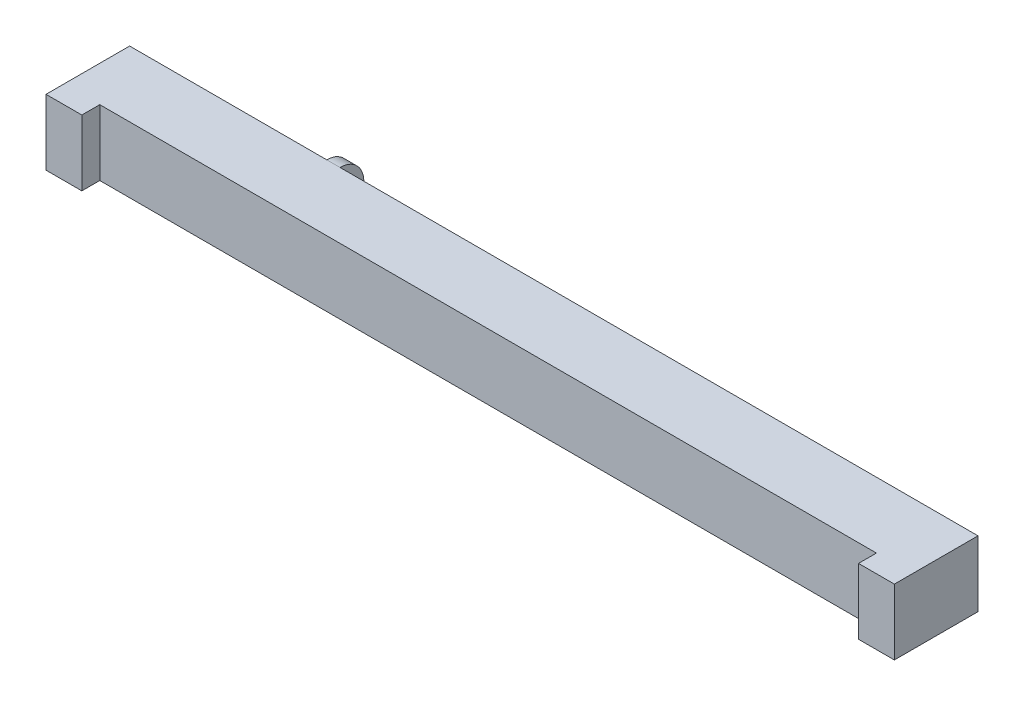
from build123d import *

# Parameters (mm, degrees)
SKETCH1_W          = 71
SKETCH1_H          = 7
EXTRUDE1_DEPTH     = 5.5
SKETCH2_W          = 65
SKETCH2_H          = 2.766320183
CUT_EXTRUDE1_DEPTH = 7.5
SKETCH3_W          = 63
SKETCH3_H          = 2
EXTRUDE2_DEPTH     = 5.5
SKETCH4_W          = 49.4
SKETCH4_H          = 2
SKETCH4_W_2        = 12.5
CUT_EXTRUDE2_DEPTH = 2.9
FILLET1_R          = 2
EXTRUDE3_START     = 1.955331485
EXTRUDE3_DEPTH     = 2.978778395
EXTRUDE3_START_2   = -35.5
EXTRUDE3_2_DEPTH   = 71


with BuildPart() as part:
    # Sketch1 → Extrude1 (new body)
    with BuildSketch(Plane(origin=(0, 0, 0), x_dir=(1, 0, 0), z_dir=(0, 1, 0))):
        Rectangle(SKETCH1_W, SKETCH1_H)
    extrude(amount=EXTRUDE1_DEPTH)

    # Sketch2 → Cut-Extrude1 (cut)
    with BuildSketch(Plane(origin=(0, 5.5, 0), x_dir=(-1, 0, 0), z_dir=(0, 1, 0))):
        with Locations((0, 3.383160092)):
            Rectangle(SKETCH2_W, SKETCH2_H)
    extrude(amount=-CUT_EXTRUDE1_DEPTH, mode=Mode.SUBTRACT)

    # Sketch3 → Extrude2 (add)
    with BuildSketch(Plane(origin=(0, 5.5, 0), x_dir=(-1, 0, 0), z_dir=(0, 1, 0))):
        with Locations((0, -4.5)):
            Rectangle(SKETCH3_W, SKETCH3_H)
    extrude(amount=-EXTRUDE2_DEPTH)

    # Sketch4 → Cut-Extrude2 (cut)
    with BuildSketch(Plane(origin=(0, 5.5, 0), x_dir=(-1, 0, 0), z_dir=(0, 1, 0))):
        with Locations((-6.8, -4.5)):
            Rectangle(SKETCH4_W, SKETCH4_H)
        with Locations((25.25, -4.5)):
            Rectangle(SKETCH4_W_2, SKETCH4_H)
    extrude(amount=-CUT_EXTRUDE2_DEPTH, mode=Mode.SUBTRACT)

    # Fillet1
    fillet1_edges = [part.edges().sort_by_distance(p)[0] for p in [
        (-18.45, 5.5, -5.5),
    ]]
    fillet(fillet1_edges, radius=FILLET1_R)

    # Extrude3: read off the stored shape, not the designer's step
    # Extrude3 outline → Extrude3 (cut)
    with BuildSketch(Plane(origin=(0, 0, 0), x_dir=(1, 0, 0), z_dir=(0, 1, 0)).offset(EXTRUDE3_START)):
        Polygon((-19, 3.5), (-34.670728733, 3.5), (-35.248026649, 0.655722687), (35.324444086, 0.655722687), (34.74714617, 3.5), (-17.9, 3.5), (-18.45, 0.790216232), align=None)
    extrude(amount=EXTRUDE3_DEPTH, mode=Mode.SUBTRACT)

    # Extrude3 2 outline → Extrude3 2 (add)
    with BuildSketch(Plane.YZ.offset(EXTRUDE3_START_2)):
        Polygon((1.955331485, -3.5), (3.133469723, -3.5), (1.955331485, -0.655722687), align=None)
    extrude(amount=EXTRUDE3_2_DEPTH)


solid = part.part
